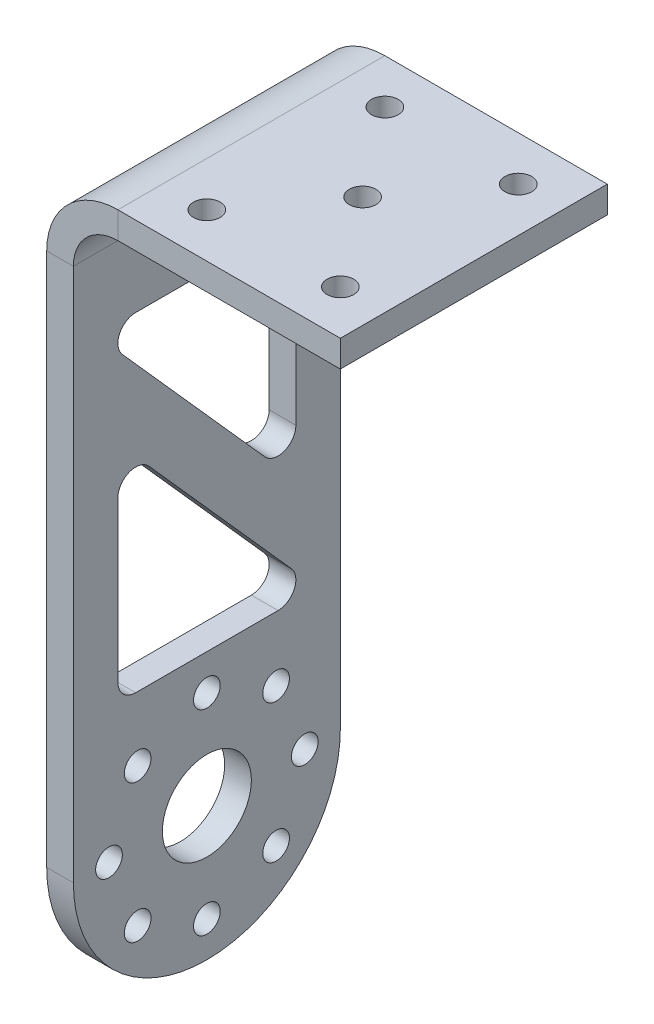
from build123d import *

# Parameters (mm, degrees)
BASIS_BLECH1_DEPTH                   = 15
SCHNITT_LINEAR_AUSTRAGEN1_DEPTH      = 76.822160349
SCHNITT_LINEAR_AUSTRAGEN1_DEPTH_BACK = 76.822160349
SKIZZE2_R                            = 5
VERRUNDUNG1_R                        = 15
F_3_0_3_DURCHMESSER_BOHRUNG1_D       = 3
F_3_0MM_DOWEL_HOLE1_D                = 3


# Sheet-metal steps are written as plain solids
with BuildPart() as part:
    # Skizze1 → Basis-Blech1 (new, symmetric)
    with BuildSketch(Plane.XY):
        with BuildLine():
            Line((0, -15), (0, 60))
            ThreePointArc((0, 60), (1.464466094, 63.535533906), (5, 65))
            Line((5, 65), (30, 65))
            Line((30, 65), (30, 68))
            Line((30, 68), (5, 68))
            ThreePointArc((5, 68), (-0.656854249, 65.656854249), (-3, 60))
            Line((-3, 60), (-3, -15))
            Line((-3, -15), (0, -15))
        make_face()
    extrude(amount=BASIS_BLECH1_DEPTH, both=True)

    # Skizze2 → Schnitt-Linear austragen1 (cut, two sides: drawn at the far end of the back side and taken through both)
    with BuildSketch(Plane(origin=(0, 0, 0), x_dir=(0, 0, -1), z_dir=(1, 0, 0)).offset(-SCHNITT_LINEAR_AUSTRAGEN1_DEPTH_BACK)):
        Circle(SKIZZE2_R)
        with BuildLine():
            Line((-8, 52), (8, 52))
            ThreePointArc((8, 52), (9.414213562, 51.414213562), (10, 50))
            Line((10, 50), (10, 32.035443619))
            ThreePointArc((10, 32.035443619), (8.711675965, 30.166348298), (6.506482679, 30.705253403))
            Line((6.506482679, 30.705253403), (-9.493517321, 48.669809784))
            ThreePointArc((-9.493517321, 48.669809784), (-9.824880877, 50.818419076), (-8, 52))
        make_face()
        with BuildLine():
            Line((-6.506482679, 36.294746597), (9.493517321, 18.330190216))
            ThreePointArc((9.493517321, 18.330190216), (9.824880877, 16.181580924), (8, 15))
            Line((8, 15), (-8, 15))
            ThreePointArc((-8, 15), (-9.414213562, 15.585786438), (-10, 17))
            Line((-10, 17), (-10, 34.964556381))
            ThreePointArc((-10, 34.964556381), (-8.711675965, 36.833651702), (-6.506482679, 36.294746597))
        make_face()
    extrude(amount=SCHNITT_LINEAR_AUSTRAGEN1_DEPTH + SCHNITT_LINEAR_AUSTRAGEN1_DEPTH_BACK, mode=Mode.SUBTRACT)

    # Verrundung1
    verrundung1_edges = [part.edges().sort_by_distance(p)[0] for p in [
        (-1.5, -15, -15),
        (-1.5, -15, 15),
    ]]
    fillet(verrundung1_edges, radius=VERRUNDUNG1_R - 0.0001)  # a hair under: the kernel refuses the full size

    # Ø3.0 (3) Durchmesser Bohrung1 (through all)
    with Locations(Plane(origin=(0, 0, 0), x_dir=(0, 0, -1), z_dir=(1, 0, 0))):
        with Locations((11, 0), (7.778174593, 7.778174593), (0, 11), (-7.778174593, 7.778174593), (-11, 0), (-7.778174593, -7.778174593), (0, -11), (7.778174593, -7.778174593)):
            Hole(F_3_0_3_DURCHMESSER_BOHRUNG1_D / 2)

    # Ø3.0mm Dowel Hole1 (through all)
    with Locations(Plane(origin=(0, 68, 0), x_dir=(1, 0, 0), z_dir=(0, 1, 0))):
        with Locations((10, 10), (25, 10), (17.5, 0), (10, -10), (25, -10)):
            Hole(F_3_0MM_DOWEL_HOLE1_D / 2)


solid = part.part
